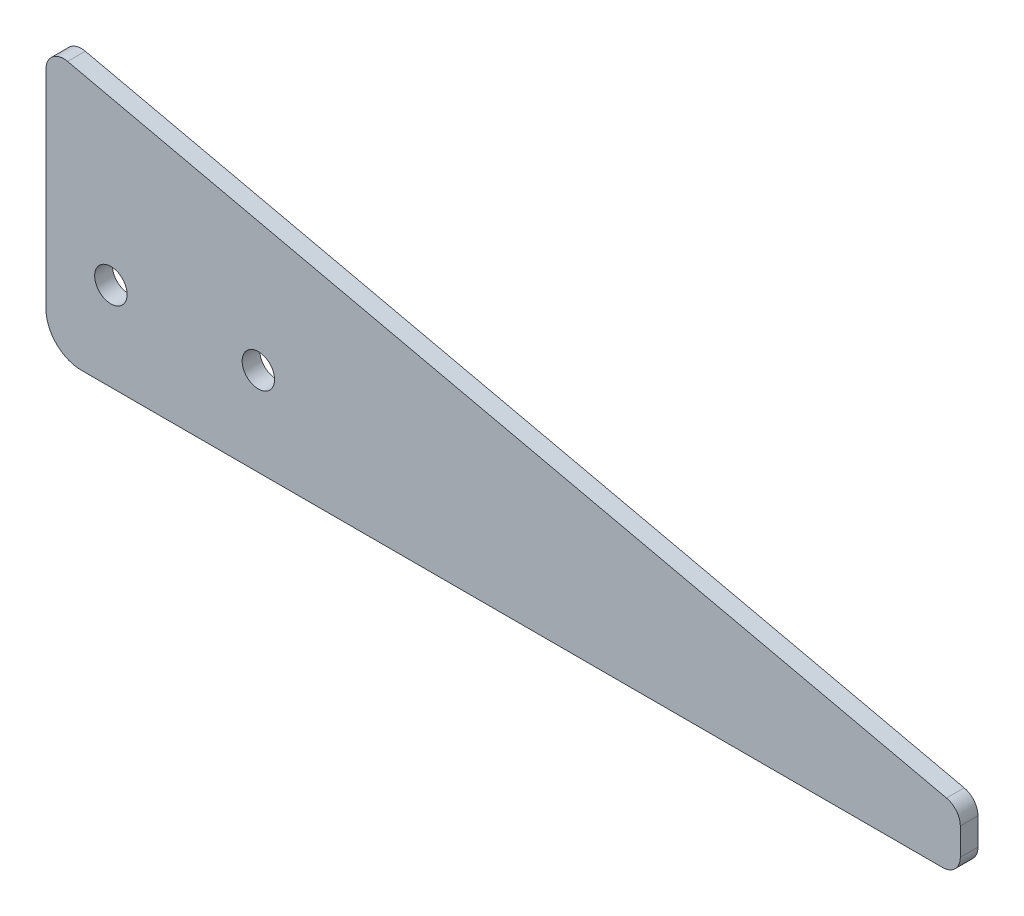
from build123d import *

# Parameters (mm, degrees)
BASE_FLANGE1_DEPTH = 3
SKETCH6_R          = 2.75
CUT_EXTRUDE1_DEPTH = 10


# Sheet-metal steps are written as plain solids
with BuildPart() as part:
    # Sketch1 → Base-Flange1 (new body)
    with BuildSketch(Plane.XY):
        with BuildLine():
            Line((6, 0), (152, 0))
            ThreePointArc((152, 0), (154.121320344, 0.878679656), (155, 3))
            Line((155, 3), (155, 7.601887371))
            ThreePointArc((155, 7.601887371), (154.343325398, 9.475073448), (152.660782614, 10.528210377))
            Line((152.660782614, 10.528210377), (3.660782614, 44.173371668))
            ThreePointArc((3.660782614, 44.173371668), (1.126813923, 43.59037406), (0, 41.247048662))
            Line((0, 41.247048662), (0, 6))
            ThreePointArc((0, 6), (1.757359313, 1.757359313), (6, 0))
        make_face()
    extrude(amount=-BASE_FLANGE1_DEPTH)

    # Sketch6 → Cut-Extrude1 (cut)
    with BuildSketch(Plane(origin=(0, 0, -3), x_dir=(-1, 0, 0), z_dir=(0, 0, -1))):
        with Locations((-11, 15)):
            Circle(SKETCH6_R)
        with Locations((-36, 15)):
            Circle(SKETCH6_R)
    extrude(amount=-CUT_EXTRUDE1_DEPTH, mode=Mode.SUBTRACT)


solid = part.part
